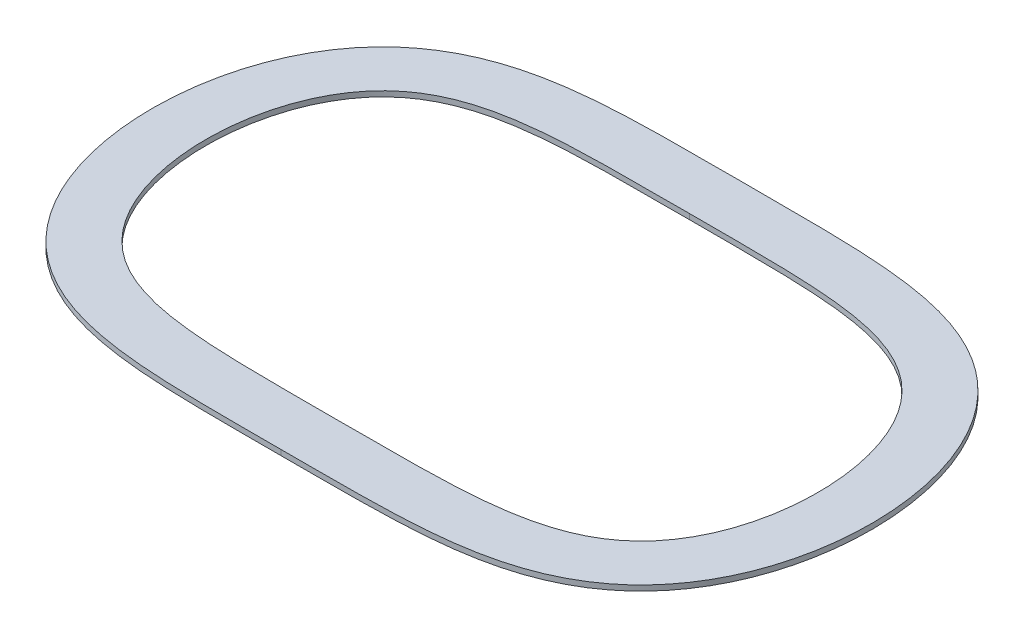
from build123d import *

# Parameters (mm, degrees)
BODY_DEPTH       = 3
CUT_INSIDE_DEPTH = 50


with BuildPart() as part:
    # Sketch1 → body (new body)
    with BuildSketch(Plane(origin=(0, 0, 0), x_dir=(1, 0, 0), z_dir=(0, 1, 0))):
        with BuildLine():
            add(Edge.make_bspline(
                [(0, 129.099444874), (4.329825716, 129.099856757), (12.989477034, 129.099521717), (25.976301205, 129.099245615), (43.290249676, 129.013980379), (60.600663959, 128.671189087), (77.894655735, 127.812916551), (95.543037977, 126.045988358), (113.01399335, 122.896019952), (130.046357946, 117.797143556), (146.158139311, 110.226946457), (160.431314667, 100.265018203), (172.693338202, 87.911885541), (182.663351285, 73.663423027), (190.340438043, 58.079107996), (195.865426103, 41.62272021), (199.400795759, 24.636185909), (201.069948812, 7.370686111), (200.935166589, -9.973525735), (198.991239132, -27.210718658), (195.166319776, -44.135428769), (189.328734448, -60.48538478), (181.314677982, -75.901802403), (170.994375318, -89.90233662), (157.866189481, -102.437720294), (141.967900724, -112.68294779), (124.642016349, -119.756709815), (106.708377896, -124.219228333), (88.446200884, -126.903428265), (70.051310284, -128.322663007), (45.62975056, -129.099776243), (25.349069661, -129.099346893), (10.139933531, -129.099445048), (-2.223e-06, -129.099444874)],
                knots=[0, 0, 0, 0, 0, 0.03122023, 0.062440461, 0.093641547, 0.124842633, 0.156052703, 0.187262773, 0.221451125, 0.252661674, 0.283871788, 0.315081907, 0.34629216, 0.377502474, 0.408712793, 0.439923128, 0.471133499, 0.502343874, 0.533554233, 0.564764591, 0.595974957, 0.627185296, 0.658395569, 0.689605838, 0.720816286, 0.757370802, 0.793925658, 0.823852077, 0.853778496, 0.890332223, 0.92688595, 1, 1, 1, 1, 1], degree=4))
            add(Edge.make_bspline(
                [(0, 129.099444874), (-4.329825716, 129.099856832), (-12.989477034, 129.099521941), (-25.976301205, 129.099246062), (-43.290249678, 129.013981124), (-60.600663967, 128.67119013), (-77.894655757, 127.812917893), (-95.543038029, 126.045990003), (-113.013993457, 122.896021898), (-130.04635814, 117.797145795), (-146.158139636, 110.226948973), (-160.431315164, 100.265020966), (-172.693338911, 87.911888514), (-182.663352239, 73.663426172), (-190.340439266, 58.079111273), (-195.865427609, 41.622723582), (-199.400797558, 24.636189342), (-201.069950908, 7.370689573), (-200.935168983, -9.973522276), (-198.991241823, -27.210715232), (-195.166322759, -44.135425409), (-189.328737713, -60.48538152), (-181.314681512, -75.901799281), (-170.994379089, -89.902333676), (-157.866193468, -102.437717576), (-141.967904887, -112.682945345), (-124.642020634, -119.756707669), (-106.708382258, -124.219226496), (-88.446205291, -126.903426743), (-70.051314717, -128.322661801), (-45.629755005, -129.099775457), (-25.349074106, -129.099346457), (-10.139937977, -129.099444874), (-2.223e-06, -129.099444874)],
                knots=[0, 0, 0, 0, 0, 0.03122023, 0.062440461, 0.093641547, 0.124842633, 0.156052703, 0.187262773, 0.221451125, 0.252661674, 0.283871788, 0.315081907, 0.34629216, 0.377502474, 0.408712793, 0.439923128, 0.471133499, 0.502343874, 0.533554233, 0.564764591, 0.595974957, 0.627185296, 0.658395569, 0.689605838, 0.720816286, 0.757370802, 0.793925658, 0.823852077, 0.853778496, 0.890332223, 0.92688595, 1, 1, 1, 1, 1], degree=4))
        make_face()
    extrude(amount=BODY_DEPTH)

    # Sketch6 → cut-inside (cut)
    with BuildSketch(Plane(origin=(0, 3, 0), x_dir=(1, 0, 0), z_dir=(0, 1, 0))):
        with BuildLine():
            add(Edge.make_bspline(
                [(-1.706e-06, -99.099444874), (4.796310554, -99.099444956), (9.592626984, -99.10000195), (19.185217445, -99.095452084), (23.981491685, -99.090373073), (33.573841551, -99.053682079), (38.369917642, -99.022132332), (47.961599661, -98.896223734), (52.757942544, -98.801978653), (62.346668013, -98.496182152), (67.133591101, -98.284990185), (76.682804597, -97.669595658), (81.445138122, -97.265730948), (90.931585037, -96.158525757), (95.655803311, -95.45600711), (102.698898177, -94.063478378), (105.039342127, -93.542460404), (108.536595349, -92.655837544), (109.700103602, -92.342722848), (112.022139549, -91.677468054), (113.181651353, -91.324934182), (118.924628295, -89.468007915), (123.37470726, -87.674506756), (129.764272253, -84.3748475), (131.846503077, -83.173325015), (134.889851922, -81.200316647), (135.893990208, -80.511868541), (137.853569241, -79.090265343), (138.810050934, -78.356706371), (143.477080307, -74.576257283), (146.840688798, -71.190621496), (150.618570925, -66.542023785), (151.352826978, -65.591487384), (152.779676323, -63.649735755), (153.47330002, -62.65699035), (155.486308643, -59.629227454), (156.725272369, -57.564739694), (160.169609974, -51.24965822), (162.10536169, -46.878754355), (164.560375817, -40.122219352), (165.303267983, -37.83637574), (166.310844769, -34.359971482), (166.629065174, -33.192230281), (167.226835042, -30.856733418), (167.506952657, -29.687143215), (168.817757437, -23.830381124), (169.581557742, -19.117017718), (170.599868705, -9.640310667), (170.853948754, -4.876924764), (170.858640841, 2.305095664), (170.79710567, 4.705294849), (170.607546129, 8.315138132), (170.528009174, 9.520831222), (170.337082883, 11.920893042), (170.225628463, 13.116992873), (169.588313139, 19.07781528), (168.824301051, 23.783993983), (166.755081961, 33.06331133), (165.450667884, 37.636644897), (163.019259231, 44.379929883), (162.129108619, 46.608103828), (160.659277537, 49.917275227), (160.145553645, 51.017335116), (159.077970232, 53.189384205), (158.524047875, 54.261815085), (155.650247867, 59.553614092), (153.020633466, 63.563825661), (149.240054661, 68.243302326), (148.459112887, 69.162433347), (146.845104901, 70.965497215), (146.00939579, 71.851957399), (143.447485136, 74.429014375), (141.663411404, 76.041651896), (136.0871113, 80.569345115), (132.069770494, 83.172747869), (126.707769529, 85.955848604), (125.615586669, 86.490295392), (123.417638235, 87.505688622), (122.311154412, 87.987223175), (118.971061676, 89.359916523), (116.716843071, 90.179274999), (109.884969342, 92.396208166), (105.238859439, 93.555299203), (98.174161342, 94.9611158), (95.803181116, 95.373698626), (91.03459072, 96.106090526), (88.646452062, 96.424440905), (81.480991459, 97.262972359), (76.698563151, 97.668492179), (67.126812691, 98.285527095), (62.337472601, 98.496537388), (52.754651531, 98.802026149), (47.961161515, 98.896250342), (38.371957167, 99.022102567), (33.576238537, 99.053609687), (23.983866157, 99.090308027), (19.18721059, 99.095448086), (9.593703868, 99.100224055), (4.796854173, 99.099901048), (-2.58e-07, 99.099444738)],
                knots=[0, 0, 0, 0, 0.03125, 0.03125, 0.0625, 0.0625, 0.09375, 0.09375, 0.125, 0.125, 0.15625, 0.15625, 0.1875, 0.1875, 0.21875, 0.21875, 0.234375, 0.234375, 0.2421875, 0.2421875, 0.25, 0.25, 0.28125, 0.28125, 0.296875, 0.296875, 0.3046875, 0.3046875, 0.3125, 0.3125, 0.34375, 0.34375, 0.3515625, 0.3515625, 0.359375, 0.359375, 0.375, 0.375, 0.40625, 0.40625, 0.421875, 0.421875, 0.4296875, 0.4296875, 0.4375, 0.4375, 0.46875, 0.46875, 0.5, 0.5, 0.515625, 0.515625, 0.5234375, 0.5234375, 0.53125, 0.53125, 0.5625, 0.5625, 0.59375, 0.59375, 0.609375, 0.609375, 0.6171875, 0.6171875, 0.625, 0.625, 0.65625, 0.65625, 0.6640625, 0.6640625, 0.671875, 0.671875, 0.6875, 0.6875, 0.71875, 0.71875, 0.7265625, 0.7265625, 0.734375, 0.734375, 0.75, 0.75, 0.78125, 0.78125, 0.796875, 0.796875, 0.8125, 0.8125, 0.84375, 0.84375, 0.875, 0.875, 0.90625, 0.90625, 0.9375, 0.9375, 0.96875, 0.96875, 1, 1, 1, 1], degree=3))
            add(Edge.make_bspline(
                [(-2.58e-07, 99.099444738), (-4.796405433, 99.099901088), (-9.59280961, 99.100224071), (-19.185577403, 99.095449823), (-23.981940717, 99.090312254), (-33.574469663, 99.053620587), (-38.3706357, 99.022120608), (-47.962497172, 98.896233616), (-52.758933989, 98.801951105), (-62.347828063, 98.496147716), (-67.134842293, 98.284967356), (-76.684237054, 97.669460333), (-81.446665881, 97.265512343), (-90.933346225, 96.158278209), (-95.657711752, 95.455885984), (-102.701004236, 94.06314034), (-105.041497431, 93.541882071), (-108.538850483, 92.655032794), (-109.702398804, 92.341884249), (-112.024531166, 91.676663556), (-113.184031854, 91.324216935), (-118.926837066, 89.467623589), (-123.376415491, 87.673358892), (-129.766119896, 84.373952686), (-131.848396428, 83.172429024), (-134.891740334, 81.199120966), (-135.895845929, 80.510564283), (-137.855174593, 79.088954728), (-138.811562869, 78.355405957), (-143.47826719, 74.575059234), (-146.841750003, 71.189356251), (-150.619734624, 66.540604924), (-151.354025183, 65.590035332), (-152.780908859, 63.648151861), (-153.474584788, 62.655208833), (-155.487305306, 59.627509686), (-156.726158944, 57.563060001), (-160.170409325, 51.248092738), (-162.106056422, 46.877100687), (-164.561045145, 40.120313467), (-165.303910661, 37.834347614), (-166.311459387, 34.357722792), (-166.629647192, 33.189993559), (-167.227349383, 30.85458015), (-167.507440135, 29.685026484), (-168.81812286, 23.82842017), (-169.581843997, 19.115094008), (-170.600013492, 9.638303628), (-170.854027807, 4.874796678), (-170.858606726, -2.307524628), (-170.797027469, -4.707844492), (-170.607382724, -8.317901124), (-170.527820973, -9.523558957), (-170.336853646, -11.923498562), (-170.225379643, -13.119544617), (-169.587969747, -19.080134513), (-168.82388537, -23.786240904), (-166.754491428, -33.065646543), (-165.449890282, -37.639119626), (-163.018144648, -44.382810904), (-162.127857368, -46.611149693), (-160.657735577, -49.920607105), (-160.143913378, -51.020739039), (-159.076341986, -53.19256072), (-158.522437559, -54.26490405), (-155.648694899, -59.556337289), (-153.018760893, -63.566307268), (-149.237846303, -68.245969093), (-148.456813877, -69.165143643), (-146.842551879, -70.968292448), (-146.006722495, -71.854739441), (-143.444948633, -74.431327099), (-141.661001878, -76.043836518), (-136.084774797, -80.571117939), (-132.066998419, -83.174109428), (-126.704630503, -85.957546345), (-125.612381148, -86.492055419), (-123.414579666, -87.50728383), (-122.308133484, -87.988660862), (-118.968105608, -89.360850549), (-116.713919434, -90.180016853), (-109.882239411, -92.397164944), (-105.235945093, -93.555912203), (-98.170885869, -94.961548938), (-95.799786859, -95.374183321), (-91.030888487, -96.106609036), (-88.643104762, -96.424891427), (-81.477977641, -97.263330908), (-76.695753912, -97.668734274), (-67.124395212, -98.285607699), (-62.335243721, -98.496614133), (-52.752787099, -98.80207357), (-47.959472259, -98.896254093), (-38.370615404, -99.022119356), (-33.575068758, -99.053674157), (-23.983034135, -99.09036944), (-19.186544044, -99.095450639), (-9.593363899, -99.100001924), (-4.796672877, -99.099444874), (-1.706e-06, -99.099444874)],
                knots=[0, 0, 0, 0, 0.03125, 0.03125, 0.0625, 0.0625, 0.09375, 0.09375, 0.125, 0.125, 0.15625, 0.15625, 0.1875, 0.1875, 0.21875, 0.21875, 0.234375, 0.234375, 0.2421875, 0.2421875, 0.25, 0.25, 0.28125, 0.28125, 0.296875, 0.296875, 0.3046875, 0.3046875, 0.3125, 0.3125, 0.34375, 0.34375, 0.3515625, 0.3515625, 0.359375, 0.359375, 0.375, 0.375, 0.40625, 0.40625, 0.421875, 0.421875, 0.4296875, 0.4296875, 0.4375, 0.4375, 0.46875, 0.46875, 0.5, 0.5, 0.515625, 0.515625, 0.5234375, 0.5234375, 0.53125, 0.53125, 0.5625, 0.5625, 0.59375, 0.59375, 0.609375, 0.609375, 0.6171875, 0.6171875, 0.625, 0.625, 0.65625, 0.65625, 0.6640625, 0.6640625, 0.671875, 0.671875, 0.6875, 0.6875, 0.71875, 0.71875, 0.7265625, 0.7265625, 0.734375, 0.734375, 0.75, 0.75, 0.78125, 0.78125, 0.796875, 0.796875, 0.8125, 0.8125, 0.84375, 0.84375, 0.875, 0.875, 0.90625, 0.90625, 0.9375, 0.9375, 0.96875, 0.96875, 1, 1, 1, 1], degree=3))
        make_face()
    extrude(amount=-CUT_INSIDE_DEPTH, mode=Mode.SUBTRACT)


solid = part.part
